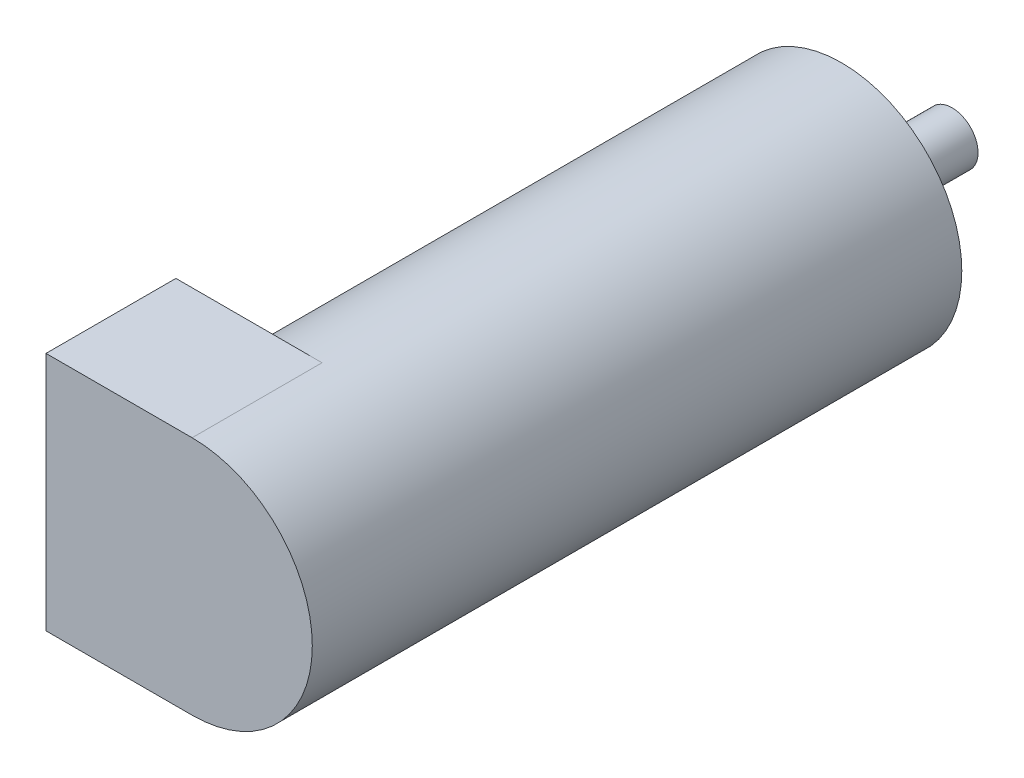
from build123d import *

# Parameters (mm, degrees)
SKETCH_1_R          = 18.5
EXTRUDE_1_DEPTH     = 80
EXTRUDE_2_DEPTH     = 20
SKETCH_3_R          = 4
EXTRUDE_3_DEPTH     = 17
SKETCH_4_R          = 1.5
CUT_EXTRUDE_1_DEPTH = 3


with BuildPart() as part:
    # Эскиз1 → Бобышка-Вытянуть1 (new body)
    with BuildSketch(Plane.XY):
        Circle(SKETCH_1_R)
    extrude(amount=EXTRUDE_1_DEPTH)

    # Эскиз2 → Бобышка-Вытянуть2 (add)
    with BuildSketch(Plane.XY.offset(80)):
        with BuildLine():
            Line((0, 18.5), (-22.5, 18.5))
            Line((-22.5, 18.5), (-22.5, -18.5))
            Line((-22.5, -18.5), (0, -18.5))
            ThreePointArc((0, -18.5), (18.5, 0), (0, 18.5))
        make_face()
    extrude(amount=EXTRUDE_2_DEPTH)

    # Эскиз3 → Бобышка-Вытянуть3 (add)
    with BuildSketch(Plane(origin=(0, 0, 0), x_dir=(-1, 0, 0), z_dir=(0, 0, -1))):
        Circle(SKETCH_3_R)
    extrude(amount=EXTRUDE_3_DEPTH)

    # Эскиз4 → Вырез-Вытянуть1 (cut)
    with BuildSketch(Plane(origin=(0, 0, 0), x_dir=(-1, 0, 0), z_dir=(0, 0, -1))):
        with Locations((15, 0)):
            Circle(SKETCH_4_R)
        with Locations((0, 15)):
            Circle(SKETCH_4_R)
        with Locations((-15, 0)):
            Circle(SKETCH_4_R)
        with Locations((0, -15)):
            Circle(SKETCH_4_R)
    extrude(amount=-CUT_EXTRUDE_1_DEPTH, mode=Mode.SUBTRACT)


solid = part.part
